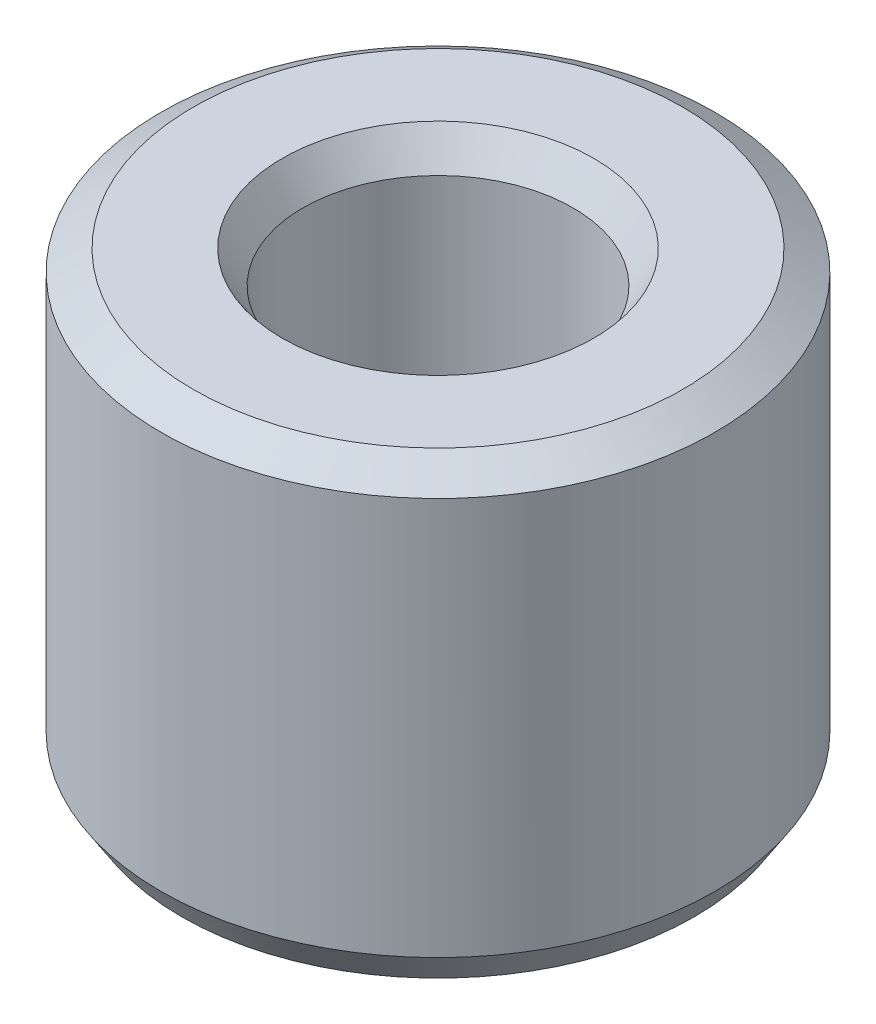
from build123d import *
from OCP.BRepFilletAPI import BRepFilletAPI_MakeChamfer

# Parameters (mm, degrees)
SKETCH1_R           = 35
BOSS_EXTRUDE1_DEPTH = 56.937156784
SKETCH2_R           = 17.054333655
CUT_EXTRUDE1_DEPTH  = 76.444282903
CHAMFER1_SIZE       = 2.622459086
CHAMFER1_SIZE2      = 4.0985313


with BuildPart() as part:
    # Sketch1 → Boss-Extrude1 (new body)
    with BuildSketch(Plane(origin=(0, 0, 0), x_dir=(1, 0, 0), z_dir=(0, 1, 0))):
        Circle(SKETCH1_R)
    extrude(amount=BOSS_EXTRUDE1_DEPTH)

    # Sketch2 → Cut-Extrude1 (cut, through all)
    with BuildSketch(Plane(origin=(0, 0, 0), x_dir=(1, 0, 0), z_dir=(0, 1, 0))):
        Circle(SKETCH2_R)
    extrude(amount=CUT_EXTRUDE1_DEPTH, mode=Mode.SUBTRACT)

    # Chamfer1: one chamfer whose edges measure the first distance from different faces: ONE call of the kernel's chamfer builder (chamfer() names one face for all edges)
    chamfer1_edges_1 = [part.edges().sort_by_distance(p)[0] for p in [
        (-17.054333655, 56.937156784, 0),
    ]]
    chamfer1_side_1 = [part.faces().sort_by_distance(p)[0] for p in [
        (-34.010050506, 56.937156784, 0),
    ]]
    chamfer1_edges_2 = [part.edges().sort_by_distance(p)[0] for p in [
        (-17.054333655, 0, 0),
    ]]
    chamfer1_side_2 = [part.faces().sort_by_distance(p)[0] for p in [
        (-17.054333655, 28.468578392, 0),
    ]]
    chamfer1_edges_3 = [part.edges().sort_by_distance(p)[0] for p in [
        (-35, 0, 0),
    ]]
    chamfer1_side_3 = [part.faces().sort_by_distance(p)[0] for p in [
        (-34.010050506, 0, 0),
    ]]
    chamfer1_edges_4 = [part.edges().sort_by_distance(p)[0] for p in [
        (-35, 56.937156784, 0),
    ]]
    chamfer1_side_4 = [part.faces().sort_by_distance(p)[0] for p in [
        (-35, 28.468578392, 0),
    ]]
    chamfer1 = BRepFilletAPI_MakeChamfer(part.part.solid().wrapped)
    for e in chamfer1_edges_1:
        chamfer1.Add(CHAMFER1_SIZE, CHAMFER1_SIZE2, e.wrapped, chamfer1_side_1[0].wrapped)  # the first distance lies on this face
    for e in chamfer1_edges_2:
        chamfer1.Add(CHAMFER1_SIZE, CHAMFER1_SIZE2, e.wrapped, chamfer1_side_2[0].wrapped)  # the first distance lies on this face
    for e in chamfer1_edges_3:
        chamfer1.Add(CHAMFER1_SIZE, CHAMFER1_SIZE2, e.wrapped, chamfer1_side_3[0].wrapped)  # the first distance lies on this face
    for e in chamfer1_edges_4:
        chamfer1.Add(CHAMFER1_SIZE, CHAMFER1_SIZE2, e.wrapped, chamfer1_side_4[0].wrapped)  # the first distance lies on this face
    add(Compound.cast(chamfer1.Shape()), mode=Mode.REPLACE)


solid = part.part
